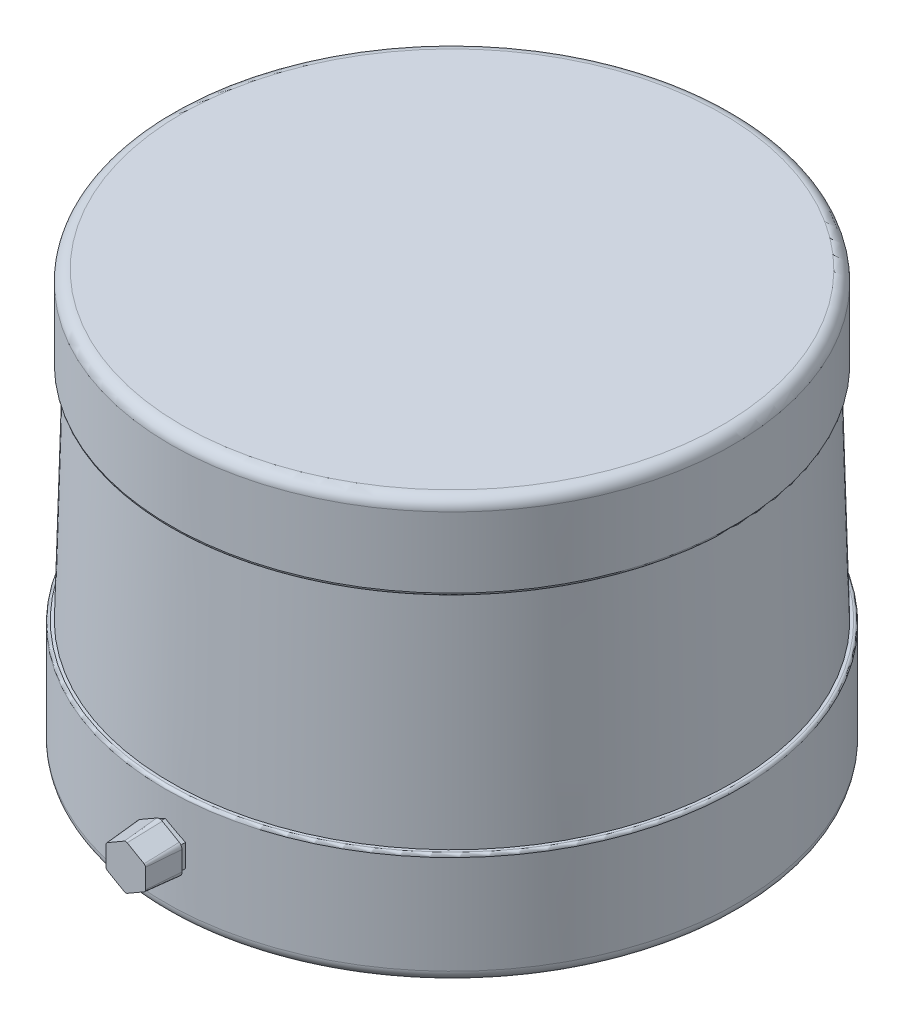
from build123d import *
from OCP.BRepFilletAPI import BRepFilletAPI_MakeChamfer

# Parameters (mm, degrees)
FILLET_1_R       = 2
FILLET_2_R       = 0.5
EXTRUDE_1_DEPTH  = 52
EXTRUDE_2_DEPTH  = 6
FILLET_3_R       = 1
CHAMFER_1_SIZE   = 6
CHAMFER_1_SIZE_2 = 0.5


with BuildPart() as part:
    # 스케치1 → 회전1 (revolve)
    with BuildSketch(Plane.XY, mode=Mode.PRIVATE) as revolve_1_sk:
        Polygon((0, 0), (51, 0), (51, 20), (50, 20), (49, 59), (50, 59), (50, 74), (0, 74), align=None)
    revolve(revolve_1_sk.sketch.rotate(Axis((0, 0, 0), (0, 1, 0)), 90), axis=Axis((0, 0, 0), (0, 1, 0)))

    # 필렛1
    fillet_1_edges = [part.edges().sort_by_distance(p)[0] for p in [
        (0, 74, 50),
        (0, 0, 51),
    ]]
    fillet(fillet_1_edges, radius=FILLET_1_R)

    # 필렛2
    fillet_2_edges = [part.edges().sort_by_distance(p)[0] for p in [
        (0, 59, 50),
        (0, 20, 51),
    ]]
    fillet(fillet_2_edges, radius=FILLET_2_R)

    # 스케치2 → 보스-돌출1 (add)
    with BuildSketch(Plane.XY):
        Polygon((0, 6.917096231), (3.5, 8.937822174), (3.5, 12.979274058), (0, 15), (-3.5, 12.979274058), (-3.5, 8.937822174), align=None)
    extrude(amount=EXTRUDE_1_DEPTH)

    # 스케치3 → 보스-돌출2 (add)
    with BuildSketch(Plane.XY.offset(52)):
        Polygon((-4, 8.649147039), (0, 6.339745962), (4, 8.649147039), (4, 13.267949192), (0, 15.577350269), (-4, 13.267949192), align=None)
    extrude(amount=EXTRUDE_2_DEPTH)

    # 필렛3
    fillet_3_edges = [part.edges().sort_by_distance(p)[0] for p in [
        (-4, 13.267949192, 55),
        (-4, 8.649147039, 55),
        (0, 6.339745962, 55),
        (4, 8.649147039, 55),
        (4, 13.267949192, 55),
        (0, 15.577350269, 55),
    ]]
    fillet(fillet_3_edges, radius=FILLET_3_R)

    # 모따기1
    chamfer_1_edges_1 = [part.edges().sort_by_distance(p)[0] for p in [
        (-2, 7.494446501, 58),
    ]]
    chamfer_1_side_1 = [part.faces().sort_by_distance(p)[0] for p in [
        (-2, 7.494446501, 57.99),
    ]]
    chamfer_1_edges_2 = [part.edges().sort_by_distance(p)[0] for p in [
        (0, 6.494446501, 58),
    ]]
    chamfer_1_side_2 = [part.faces().sort_by_distance(p)[0] for p in [
        (0, 6.494446501, 57.99),
    ]]
    chamfer_1_edges_3 = [part.edges().sort_by_distance(p)[0] for p in [
        (-3.866025404, 8.726497308, 58),
    ]]
    chamfer_1_side_3 = [part.faces().sort_by_distance(p)[0] for p in [
        (-3.866025404, 8.726497308, 57.99),
    ]]
    chamfer_1_edges_4 = [part.edges().sort_by_distance(p)[0] for p in [
        (2, 7.494446501, 58),
    ]]
    chamfer_1_side_4 = [part.faces().sort_by_distance(p)[0] for p in [
        (1.995, 7.503106755, 58),
    ]]
    chamfer_1_edges_5 = [part.edges().sort_by_distance(p)[0] for p in [
        (-4, 10.958548116, 58),
    ]]
    chamfer_1_side_5 = [part.faces().sort_by_distance(p)[0] for p in [
        (-3.99, 10.958548116, 58),
    ]]
    chamfer_1_edges_6 = [part.edges().sort_by_distance(p)[0] for p in [
        (3.866025404, 8.726497308, 58),
    ]]
    chamfer_1_side_6 = [part.faces().sort_by_distance(p)[0] for p in [
        (3.85736515, 8.731497308, 58),
    ]]
    chamfer_1_edges_7 = [part.edges().sort_by_distance(p)[0] for p in [
        (-3.866025404, 13.190598923, 58),
    ]]
    chamfer_1_side_7 = [part.faces().sort_by_distance(p)[0] for p in [
        (-3.85736515, 13.185598923, 58),
    ]]
    chamfer_1_edges_8 = [part.edges().sort_by_distance(p)[0] for p in [
        (4, 10.958548116, 58),
    ]]
    chamfer_1_side_8 = [part.faces().sort_by_distance(p)[0] for p in [
        (3.99, 10.958548116, 58),
    ]]
    chamfer_1_edges_9 = [part.edges().sort_by_distance(p)[0] for p in [
        (-2, 14.422649731, 58),
    ]]
    chamfer_1_side_9 = [part.faces().sort_by_distance(p)[0] for p in [
        (-1.995, 14.413989477, 58),
    ]]
    chamfer_1_edges_10 = [part.edges().sort_by_distance(p)[0] for p in [
        (3.866025404, 13.190598923, 58),
    ]]
    chamfer_1_side_10 = [part.faces().sort_by_distance(p)[0] for p in [
        (3.85736515, 13.185598923, 58),
    ]]
    chamfer_1_edges_11 = [part.edges().sort_by_distance(p)[0] for p in [
        (0, 15.422649731, 58),
    ]]
    chamfer_1_side_11 = [part.faces().sort_by_distance(p)[0] for p in [
        (0, 15.412649731, 58),
    ]]
    chamfer_1_edges_12 = [part.edges().sort_by_distance(p)[0] for p in [
        (2, 14.422649731, 58),
    ]]
    chamfer_1_side_12 = [part.faces().sort_by_distance(p)[0] for p in [
        (1.995, 14.413989477, 58),
    ]]
    chamfer_1 = BRepFilletAPI_MakeChamfer(part.part.solid().wrapped)
    for e in chamfer_1_edges_1:
        chamfer_1.Add(CHAMFER_1_SIZE - 0.0001, CHAMFER_1_SIZE_2 - 0.0001, e.wrapped, chamfer_1_side_1[0].wrapped)
    for e in chamfer_1_edges_2:
        chamfer_1.Add(CHAMFER_1_SIZE - 0.0001, CHAMFER_1_SIZE_2 - 0.0001, e.wrapped, chamfer_1_side_2[0].wrapped)
    for e in chamfer_1_edges_3:
        chamfer_1.Add(CHAMFER_1_SIZE - 0.0001, CHAMFER_1_SIZE_2 - 0.0001, e.wrapped, chamfer_1_side_3[0].wrapped)
    for e in chamfer_1_edges_4:
        chamfer_1.Add(CHAMFER_1_SIZE_2 - 0.0001, CHAMFER_1_SIZE - 0.0001, e.wrapped, chamfer_1_side_4[0].wrapped)
    for e in chamfer_1_edges_5:
        chamfer_1.Add(CHAMFER_1_SIZE_2 - 0.0001, CHAMFER_1_SIZE - 0.0001, e.wrapped, chamfer_1_side_5[0].wrapped)
    for e in chamfer_1_edges_6:
        chamfer_1.Add(CHAMFER_1_SIZE_2 - 0.0001, CHAMFER_1_SIZE - 0.0001, e.wrapped, chamfer_1_side_6[0].wrapped)
    for e in chamfer_1_edges_7:
        chamfer_1.Add(CHAMFER_1_SIZE_2 - 0.0001, CHAMFER_1_SIZE - 0.0001, e.wrapped, chamfer_1_side_7[0].wrapped)
    for e in chamfer_1_edges_8:
        chamfer_1.Add(CHAMFER_1_SIZE_2 - 0.0001, CHAMFER_1_SIZE - 0.0001, e.wrapped, chamfer_1_side_8[0].wrapped)
    for e in chamfer_1_edges_9:
        chamfer_1.Add(CHAMFER_1_SIZE_2 - 0.0001, CHAMFER_1_SIZE - 0.0001, e.wrapped, chamfer_1_side_9[0].wrapped)
    for e in chamfer_1_edges_10:
        chamfer_1.Add(CHAMFER_1_SIZE_2 - 0.0001, CHAMFER_1_SIZE - 0.0001, e.wrapped, chamfer_1_side_10[0].wrapped)
    for e in chamfer_1_edges_11:
        chamfer_1.Add(CHAMFER_1_SIZE_2 - 0.0001, CHAMFER_1_SIZE - 0.0001, e.wrapped, chamfer_1_side_11[0].wrapped)
    for e in chamfer_1_edges_12:
        chamfer_1.Add(CHAMFER_1_SIZE_2 - 0.0001, CHAMFER_1_SIZE - 0.0001, e.wrapped, chamfer_1_side_12[0].wrapped)
    add(Compound.cast(chamfer_1.Shape()), mode=Mode.REPLACE)  # a hair under: the kernel refuses the full size


solid = part.part
